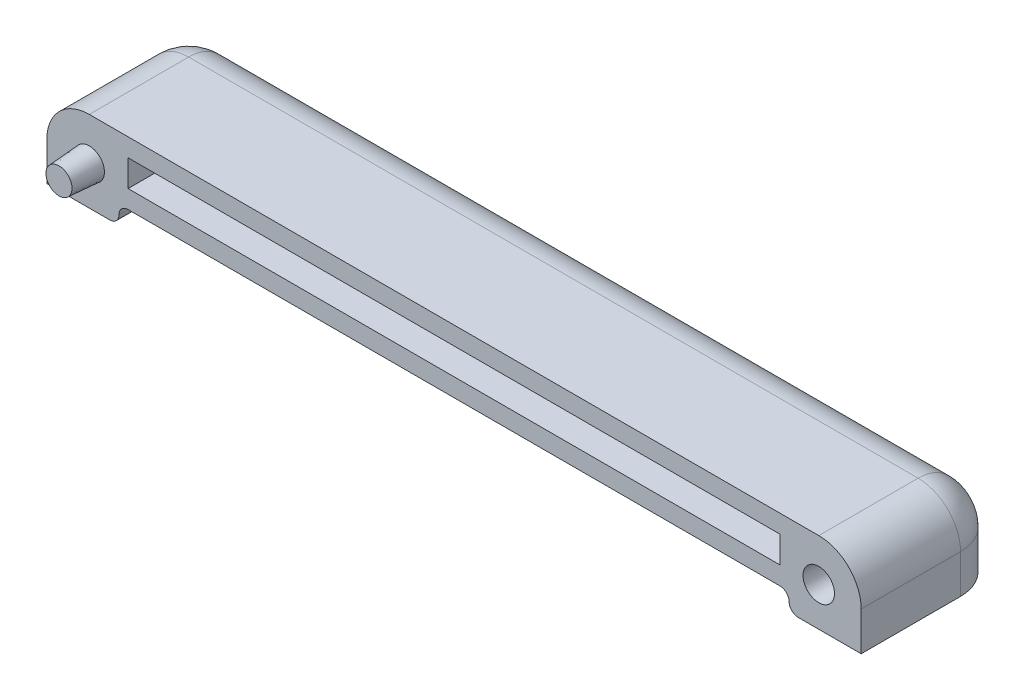
from build123d import *

# Parameters (mm, degrees)
EXTRUDE1_DEPTH     = 3
SKETCH3_W          = 134.4
SKETCH3_H          = 13.4
EXTRUDE2_DEPTH     = 7.4
SKETCH4_W          = 134.4
SKETCH4_H          = 13.4
SKETCH4_W_2        = 107.6
SKETCH4_H_2        = 4.4
EXTRUDE3_DEPTH     = 13
FILLET1_R          = 7
CUT_EXTRUDE1_DEPTH = 3
FILLET2_R          = 1.5
SKETCH7_R          = 2.5
EXTRUDE4_DEPTH     = 5
EXTRUDE4_TAPER     = 4
SKETCH8_R          = 2.6
CUT_EXTRUDE2_DEPTH = 5.2
CUT_EXTRUDE2_DRAFT = -3.8


with BuildPart() as part:
    # Sketch1 → Extrude1 (new body)
    with BuildSketch(Plane.XY):
        Polygon((-43.6, -161.948648405), (-43.6, -171.948648405), (43.6, -171.948648405), (43.6, -161.948648405), (67.2, -161.948648405), (67.2, -148.548648405), (-67.2, -148.548648405), (-67.2, -161.948648405), align=None)
    extrude(amount=EXTRUDE1_DEPTH)

    # Sketch3 → Extrude2 (add)
    with BuildSketch(Plane.XY.offset(3)):
        with Locations((0, -155.248648405)):
            Rectangle(SKETCH3_W, SKETCH3_H)
    extrude(amount=EXTRUDE2_DEPTH)

    # Sketch4 → Extrude3 (add)
    with BuildSketch(Plane.XY.offset(10.4)):
        with Locations((0, -155.248648405)):
            Rectangle(SKETCH4_W, SKETCH4_H)
        with Locations((0, -153.748648405)):
            Rectangle(SKETCH4_W_2, SKETCH4_H_2, mode=Mode.SUBTRACT)
    extrude(amount=EXTRUDE3_DEPTH)

    # Fillet1
    fillet1_edges = [part.edges().sort_by_distance(p)[0] for p in [
        (-67.2, -148.548648405, 11.7),
        (67.2, -148.548648405, 11.7),
        (-67.2, -155.248648405, 0),
        (0, -148.548648405, 0),
        (67.2, -155.248648405, 0),
    ]]
    fillet(fillet1_edges, radius=FILLET1_R)

    # Sketch6 → Cut-Extrude1 (cut)
    with BuildSketch(Plane.XZ.offset(161.948648405)):
        with BuildLine():
            Line((-55.3, 23.4), (-55.3, 18.9))
            ThreePointArc((-55.3, 18.9), (-53.249747468, 13.950252532), (-48.3, 11.9))
            Line((-48.3, 11.9), (48.3, 11.9))
            ThreePointArc((48.3, 11.9), (53.249747468, 13.950252532), (55.3, 18.9))
            Line((55.3, 18.9), (55.3, 23.4))
            Line((55.3, 23.4), (-55.3, 23.4))
        make_face()
    extrude(amount=-CUT_EXTRUDE1_DEPTH, mode=Mode.SUBTRACT)

    # Fillet2
    fillet2_edges = [part.edges().sort_by_distance(p)[0] for p in [
        (55.3, -158.948648405, 21.15),
        (53.249747468, -158.948648405, 13.950252532),
        (0, -158.948648405, 11.9),
        (-53.249747468, -158.948648405, 13.950252532),
        (-55.3, -158.948648405, 21.15),
        (-55.3, -161.948648405, 21.15),
        (-53.249747468, -161.948648405, 13.950252532),
        (55.3, -161.948648405, 21.15),
        (53.249747468, -161.948648405, 13.950252532),
        (0, -161.948648405, 11.9),
    ]]
    fillet(fillet2_edges, radius=FILLET2_R - 0.0001)  # a hair under: the kernel refuses the full size

    # Sketch7 → Extrude4 (add)
    with BuildSketch(Plane.XY.offset(23.4)):
        with Locations((-60.2, -155.548648405)):
            Circle(SKETCH7_R)
    extrude(amount=EXTRUDE4_DEPTH, taper=EXTRUDE4_TAPER)


with BuildPart() as cut_extrude2_tool:
    # Sketch8 → Cut-Extrude2 (with draft: the straight prism first)
    with BuildSketch(Plane.XY.offset(23.4)):
        with Locations((60.2, -155.548648405)):
            Circle(SKETCH8_R)
    extrude(amount=-CUT_EXTRUDE2_DEPTH)
    # Cut-Extrude2: the draft: its side faces are tilted about the plane it starts from
    cut_extrude2_sides = [cut_extrude2_tool.faces().sort_by_distance(p)[0] for p in [
        (57.6, -155.548648405, 20.8),
    ]]
    draft(cut_extrude2_sides, Plane.XY.offset(23.4), CUT_EXTRUDE2_DRAFT)


with BuildPart() as part_1:
    add(part.part)

    # Cut-Extrude2: cut by cut_extrude2_tool
    add(cut_extrude2_tool.part, mode=Mode.SUBTRACT)


solid = part_1.part
